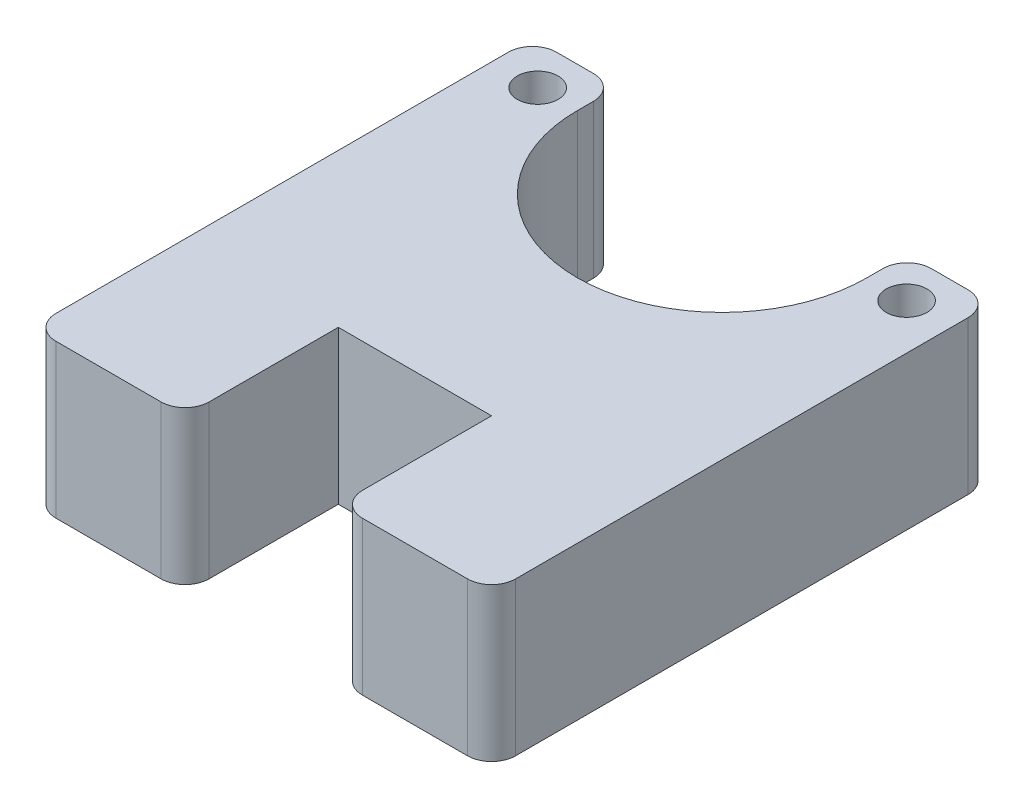
from build123d import *

# Parameters (mm, degrees)
SKETCH1_R           = 0.8449945
BOSS_EXTRUDE1_DEPTH = 6.35
FILLET3_R           = 1


with BuildPart() as part:
    # Sketch1 → Boss-Extrude1 (new body)
    with BuildSketch(Plane(origin=(0, 0, 0), x_dir=(1, 0, 0), z_dir=(0, 1, 0))):
        with BuildLine():
            Line((0, -6.35), (6.35, -6.35))
            Line((6.35, -6.35), (6.35, 0))
            Line((6.35, 0), (12.7, 0))
            Line((12.7, 0), (12.7, -6.35))
            Line((12.7, -6.35), (19.05, -6.35))
            Line((19.05, -6.35), (19.05, 14.393729658))
            Line((19.05, 14.393729658), (15.5250007, 14.393729658))
            Line((15.5250007, 14.393729658), (15.5250007, 12.7287274))
            ThreePointArc((15.5250007, 12.7287274), (9.524996571, 6.7287267), (3.5249993, 12.728734258))
            Line((3.5249993, 12.728734258), (3.5249993, 14.393729658))
            Line((3.5249993, 14.393729658), (0, 14.393729658))
            Line((0, 14.393729658), (0, -6.35))
        make_face()
        with Locations((1.88250068, 12.728734258)):
            Circle(SKETCH1_R, mode=Mode.SUBTRACT)
        with Locations((17.16749932, 12.7287274)):
            Circle(SKETCH1_R, mode=Mode.SUBTRACT)
    extrude(amount=BOSS_EXTRUDE1_DEPTH)

    # Fillet3
    fillet3_edges = [part.edges().sort_by_distance(p)[0] for p in [
        (19.05, 3.175, 6.35),
        (12.7, 3.175, 6.35),
        (6.35, 3.175, 6.35),
        (0, 3.175, 6.35),
        (19.05, 3.175, -14.393729658),
        (15.5250007, 3.175, -14.393729658),
        (3.5249993, 3.175, -14.393729658),
        (0, 3.175, -14.393729658),
    ]]
    fillet(fillet3_edges, radius=FILLET3_R)


solid = part.part
